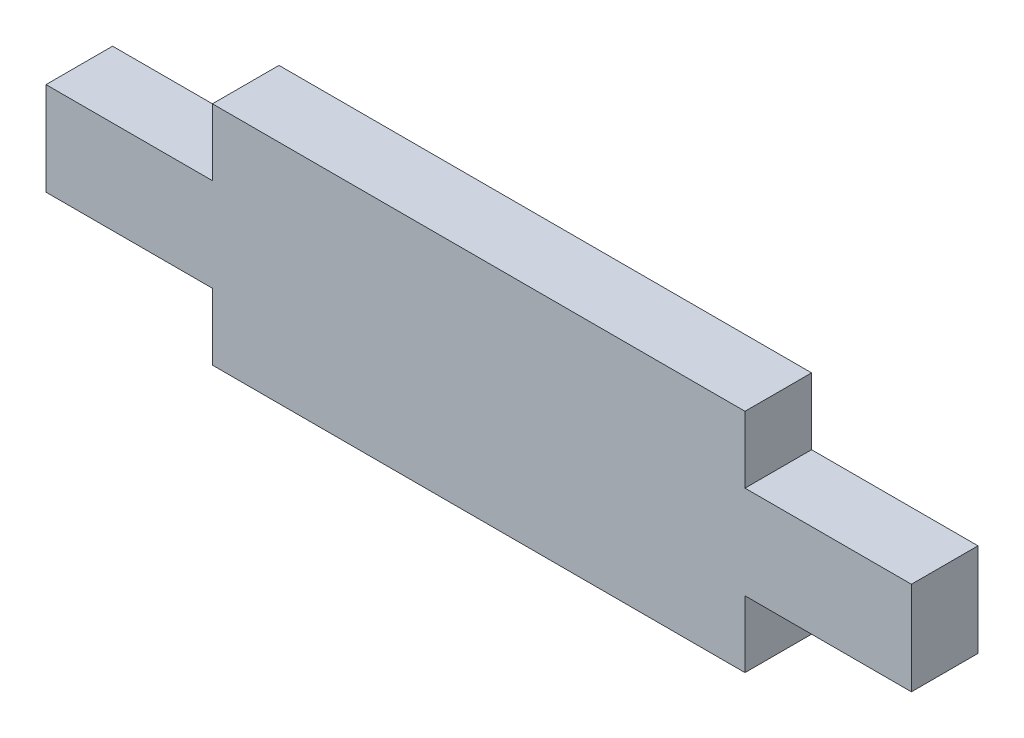
from build123d import *

# Parameters (mm, degrees)
SKIZZE1_W                       = 65
SKIZZE1_H                       = 7
AUFSATZ_LINEAR_AUSTRAGEN1_DEPTH = 5
SKIZZE2_W                       = 40
SKIZZE2_H                       = 5
AUFSATZ_LINEAR_AUSTRAGEN3_DEPTH = 5


with BuildPart() as part:
    # Skizze1 → Aufsatz-Linear austragen1 (new body)
    with BuildSketch(Plane.XY):
        with Locations((32.5, -3.5)):
            Rectangle(SKIZZE1_W, SKIZZE1_H)
    extrude(amount=AUFSATZ_LINEAR_AUSTRAGEN1_DEPTH)

    # Skizze2 → Aufsatz-Linear austragen3 (add)
    with BuildSketch(Plane(origin=(0, 0, 0), x_dir=(1, 0, 0), z_dir=(0, 1, 0))):
        with Locations((32.5, -2.5)):
            Rectangle(SKIZZE2_W, SKIZZE2_H)
    aufsatz_linear_austragen3 = extrude(amount=AUFSATZ_LINEAR_AUSTRAGEN3_DEPTH)

    # Spiegeln1: Aufsatz-Linear austragen3 across plane
    add(aufsatz_linear_austragen3.mirror(Plane.ZX.offset(-3.5)))


solid = part.part
